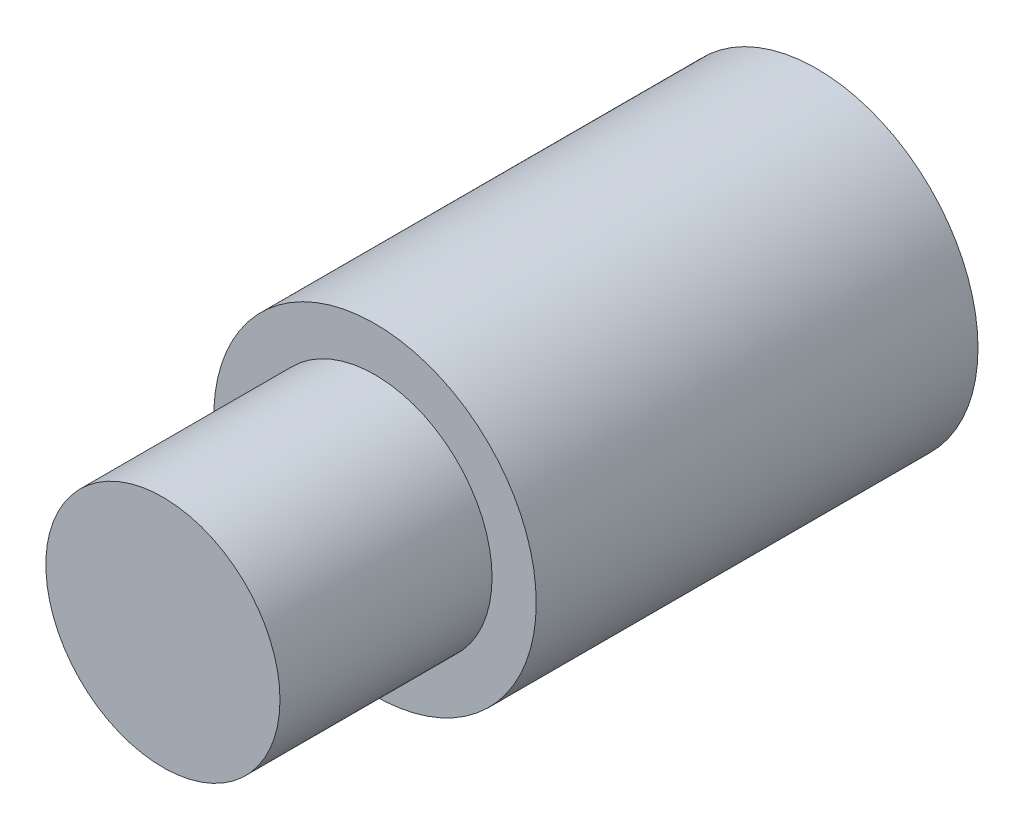
from build123d import *

# Parameters (mm, degrees)
SKETCH1_R           = 3.65
SKETCH1_R_2         = 2.8
BOSS_EXTRUDE1_DEPTH = 9
SKETCH2_R           = 3.65
BOSS_EXTRUDE2_DEPTH = 1
SKETCH3_R           = 2.65
BOSS_EXTRUDE3_DEPTH = 4.8


with BuildPart() as part:
    # Sketch1 → Boss-Extrude1 (new body)
    with BuildSketch(Plane.XY):
        Circle(SKETCH1_R)
        Circle(SKETCH1_R_2, mode=Mode.SUBTRACT)
    extrude(amount=BOSS_EXTRUDE1_DEPTH)

    # Sketch2 → Boss-Extrude2 (add)
    with BuildSketch(Plane.XY.offset(9)):
        Circle(SKETCH2_R)
    extrude(amount=BOSS_EXTRUDE2_DEPTH)

    # Sketch3 → Boss-Extrude3 (add)
    with BuildSketch(Plane.XY.offset(10)):
        Circle(SKETCH3_R)
    extrude(amount=BOSS_EXTRUDE3_DEPTH)


solid = part.part
